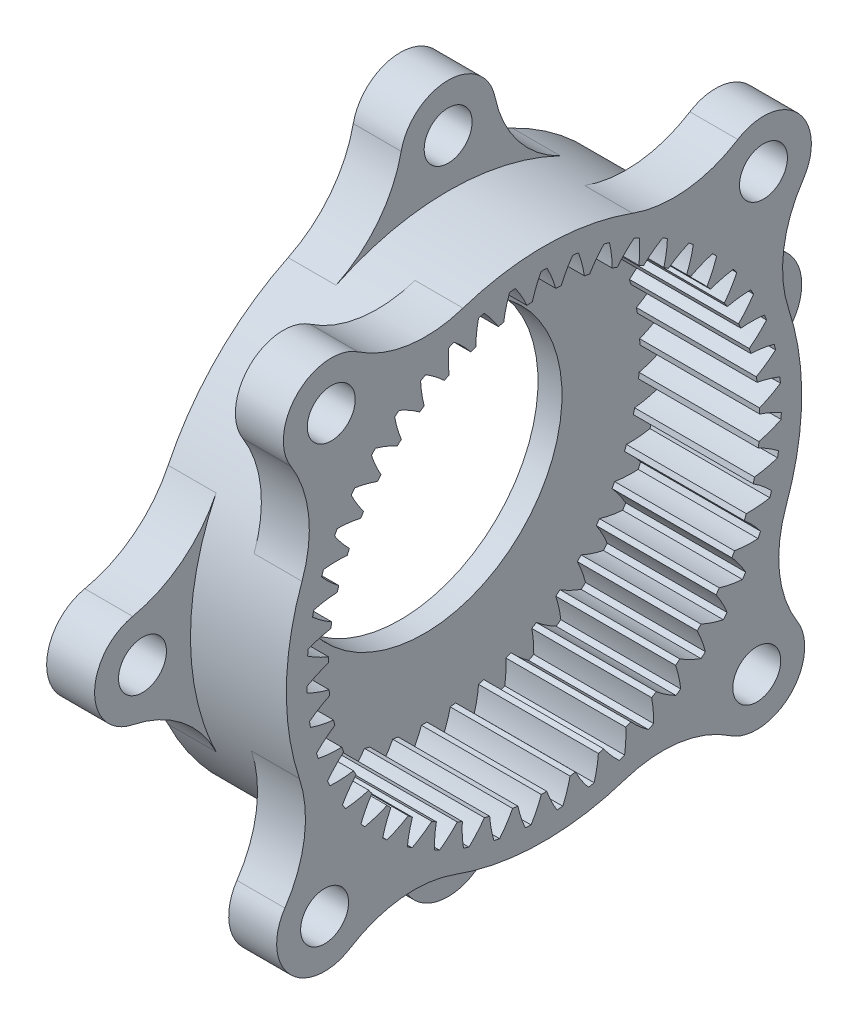
from build123d import *

# Parameters (mm, degrees)
BASPROSKE_W         = 12
BASPROSKE_H         = 3.5
TOOTHCUT_DEPTH      = 33.687918257
TEETHCUTS_COUNT     = 47
TEETHCUTS_ANGLE     = 352.340425532
BOSS_EXTRUDE1_START = -2
SKETCH1_R           = 21.5
BOSS_EXTRUDE1_DEPTH = 2
SKETCH2_R           = 11.5
CUT_EXTRUDE1_DEPTH  = 33.687918257
SKETCH3_R           = 2
BOSS_EXTRUDE3_DEPTH = 4
FILLET1_R           = 10
SKETCH6_R           = 2
BOSS_EXTRUDE4_DEPTH = 4
FILLET2_R           = 10


with BuildPart() as part:
    # BasProSke → Base-Revolve (revolve)
    with BuildSketch(Plane(origin=(0, 0, 0), x_dir=(1, 0, 0), z_dir=(0, 1, 0)), mode=Mode.PRIVATE) as base_revolve_sk:
        with Locations((6, 19.75)):
            Rectangle(BASPROSKE_W, BASPROSKE_H)
    revolve(base_revolve_sk.sketch.rotate(Axis((-10, 0, 0), (1, 0, 0)), 180), axis=Axis((-10, 0, 0), (1, 0, 0)))

    # TooCutSke → ToothCut (cut, through all)
    with BuildSketch(Plane(origin=(0, 0, 0), x_dir=(0, 0, -1), z_dir=(1, 0, 0))):
        with BuildLine():
            ThreePointArc((0.983195286, 17.947689884), (0.661245829, 18.89336655), (0.240755418, 19.799536303))
            ThreePointArc((0.240755418, 19.799536303), (0, 19.801), (-0.240755418, 19.799536303))
            ThreePointArc((-0.240755418, 19.799536303), (-0.661245829, 18.89336655), (-0.983195286, 17.947689884))
            ThreePointArc((-0.983195286, 17.947689884), (0, 17.9746), (0.983195286, 17.947689884))
        make_face()
    toothcut = extrude(amount=TOOTHCUT_DEPTH, mode=Mode.SUBTRACT)

    # TeethCuts: ToothCut ×47 about axis
    teethcuts_axis = Axis((-10, 0, 0), (1, 0, 0))
    for i in range(1, TEETHCUTS_COUNT):
        add(toothcut.rotate(teethcuts_axis, i * TEETHCUTS_ANGLE / (TEETHCUTS_COUNT - 1)), mode=Mode.SUBTRACT)

    # Sketch1 → Boss-Extrude1 (add)
    with BuildSketch(Plane.ZY.offset(BOSS_EXTRUDE1_START)):
        Circle(SKETCH1_R)
    extrude(amount=BOSS_EXTRUDE1_DEPTH)

    # Sketch2 → Cut-Extrude1 (cut, through all)
    with BuildSketch(Plane.ZY):
        Circle(SKETCH2_R)
    extrude(amount=-CUT_EXTRUDE1_DEPTH, mode=Mode.SUBTRACT)

    # Sketch3 → Boss-Extrude3 (add)
    # profile 1 of 4: a face of its own
    with BuildSketch(Plane.ZY):
        with BuildLine():
            Line((-25.5, 4), (-20.096451941, 4))
            Line((-20.096451941, 4), (-20.096451941, -4))
            Line((-20.096451941, -4), (-25.5, -4))
            ThreePointArc((-25.5, -4), (-29.5, 0), (-25.5, 4))
        make_face()
        with Locations((-25.5, 0)):
            Circle(SKETCH3_R, mode=Mode.SUBTRACT)
    # profile 2 of 4: a face of its own
    with BuildSketch(Plane.ZY):
        with BuildLine():
            Line((4, 25.5), (4, 20.096451941))
            Line((4, 20.096451941), (-4, 20.096451941))
            Line((-4, 20.096451941), (-4, 25.5))
            ThreePointArc((-4, 25.5), (0, 29.5), (4, 25.5))
        make_face()
        with Locations((0, 25.5)):
            Circle(SKETCH3_R, mode=Mode.SUBTRACT)
    # profile 3 of 4: a face of its own
    with BuildSketch(Plane.ZY):
        with BuildLine():
            Line((25.5, -4), (20.096451941, -4))
            Line((20.096451941, -4), (20.096451941, 4))
            Line((20.096451941, 4), (25.5, 4))
            ThreePointArc((25.5, 4), (29.5, 0), (25.5, -4))
        make_face()
        with Locations((25.5, 0)):
            Circle(SKETCH3_R, mode=Mode.SUBTRACT)
    # profile 4 of 4: a face of its own
    with BuildSketch(Plane.ZY):
        with BuildLine():
            Line((-4, -25.5), (-4, -20.096451941))
            Line((-4, -20.096451941), (4, -20.096451941))
            Line((4, -20.096451941), (4, -25.5))
            ThreePointArc((4, -25.5), (0, -29.5), (-4, -25.5))
        make_face()
        with Locations((0, -25.5)):
            Circle(SKETCH3_R, mode=Mode.SUBTRACT)
    extrude(amount=-BOSS_EXTRUDE3_DEPTH)

    # Fillet1
    # the kernel refuses this fillet: 10 mm, written as the material it adds along each edge
    with BuildSketch(Plane(origin=(0, -21.124630174, 4), x_dir=(0, 0.3132537299732563, 0.9496694691616879), z_dir=(1, 0, 0)), Plane(origin=(0, 21.124630174, -4), x_dir=(0, -0.3132537299732253, -0.9496694691616983), z_dir=(1, 0, 0)), Plane(origin=(0, -4, -21.124630174), x_dir=(0, -0.9496694691617331, 0.3132537299731191), z_dir=(1, 0, 0))) as fillet1_piece_1:
        with BuildLine():
            CenterArc((6.948401858, 9.913688951), FILLET1_R, 210.054590585, 52.41213662)
            Line((-1.707084322, 4.905439857), (-2.57263294, 4.404614948))
            ThreePointArc((-2.57263294, 4.404614948), (-2.320270387, 3.84190141), (-0.949669469, -0.31325373))
            Line((-0.949669469, -0.31325373), (0.131101922, -0.991368895))
            ThreePointArc((0.131101922, -0.991368895), (2.81869132, -0.814431244), (5.506280718, -0.991368895))
            Line((5.506280718, -0.991368895), (5.637382639, 0))
        make_face()
    extrude(amount=4)
    with BuildSketch(Plane(origin=(0, -4, 21.124630174), x_dir=(0, 0.01627238713686747, 0.9998675959430168), z_dir=(1, 0, 0))) as fillet1_piece_2:
        with BuildLine():
            CenterArc((7.07924631, 9.82068168), FILLET1_R, 206.72107826, 52.41213662)
            Line((-1.852813991, 5.324205419), (-2.746020021, 4.874557792))
            ThreePointArc((-2.746020021, 4.874557792), (-1.695593605, 2.394427141), (-0.979383425, -0.202010165))
            Line((-0.979383425, -0.202010165), (0.016272387, -0.999867596))
            ThreePointArc((0.016272387, -0.999867596), (4.391062896, -0.928669884), (5.00545854, -0.982068168))
            Line((5.00545854, -0.982068168), (5.193984701, 0))
        make_face()
    extrude(amount=4)
    with BuildSketch(Plane(origin=(0, 4, 21.124630174), x_dir=(0, -0.0162723871367947, 0.9998675959430179), z_dir=(1, 0, 0))) as fillet1_piece_3:
        with BuildLine():
            CenterArc((7.07924631, -9.82068168), FILLET1_R, 100.86678512, 52.41213662)
            Line((-1.852813991, -5.324205419), (-2.746020021, -4.874557792))
            ThreePointArc((-2.746020021, -4.874557792), (-1.695593605, -2.394427141), (-0.979383425, 0.202010165))
            Line((-0.979383425, 0.202010165), (0.016272387, 0.999867596))
            ThreePointArc((0.016272387, 0.999867596), (4.391062896, 0.928669884), (5.00545854, 0.982068168))
            Line((5.00545854, 0.982068168), (5.193984701, 0))
        make_face()
    extrude(amount=4)
    with BuildSketch(Plane(origin=(0, 21.124630174, 4), x_dir=(0, -0.31325372997304163, 0.9496694691617588), z_dir=(1, 0, 0)), Plane(origin=(0, 4, -21.124630174), x_dir=(0, 0.9496694691617331, 0.3132537299731191), z_dir=(1, 0, 0)), Plane(origin=(0, -21.124630174, -4), x_dir=(0, 0.3132537299729657, -0.9496694691617839), z_dir=(1, 0, 0))) as fillet1_piece_4:
        with BuildLine():
            CenterArc((6.948401858, -9.913688951), FILLET1_R, 97.533272794, 52.41213662)
            Line((-1.707084322, -4.905439857), (-2.57263294, -4.404614948))
            ThreePointArc((-2.57263294, -4.404614948), (-2.320270387, -3.84190141), (-0.949669469, 0.31325373))
            Line((-0.949669469, 0.31325373), (0.131101922, 0.991368895))
            ThreePointArc((0.131101922, 0.991368895), (2.81869132, 0.814431244), (5.506280718, 0.991368895))
            Line((5.506280718, 0.991368895), (5.637382639, 0))
        make_face()
    extrude(amount=4)

    # Sketch6 → Boss-Extrude4 (add)
    # profile 1 of 4: a face of its own
    with BuildSketch(Plane(origin=(12, 0, 0), x_dir=(0, 0, -1), z_dir=(1, 0, 0))):
        with BuildLine():
            Line((-20.578660793, 15.479472939), (-16.726697913, 11.627510059))
            Line((-16.726697913, 11.627510059), (-11.069843664, 17.284364309))
            Line((-11.069843664, 17.284364309), (-14.921806543, 21.136327188))
            ThreePointArc((-14.921806543, 21.136327188), (-20.578660793, 21.136327188), (-20.578660793, 15.479472939))
        make_face()
        with Locations((-17.750233668, 18.307900063)):
            Circle(SKETCH6_R, mode=Mode.SUBTRACT)
    # profile 2 of 4: a face of its own
    with BuildSketch(Plane(origin=(12, 0, 0), x_dir=(0, 0, -1), z_dir=(1, 0, 0))):
        with BuildLine():
            Line((11.627510059, 16.726697913), (17.284364309, 11.069843664))
            Line((17.284364309, 11.069843664), (21.136327188, 14.921806543))
            ThreePointArc((21.136327188, 14.921806543), (21.136327188, 20.578660793), (15.479472939, 20.578660793))
            Line((15.479472939, 20.578660793), (11.627510059, 16.726697913))
        make_face()
        with Locations((18.307900063, 17.750233668)):
            Circle(SKETCH6_R, mode=Mode.SUBTRACT)
    # profile 3 of 4: a face of its own
    with BuildSketch(Plane(origin=(12, 0, 0), x_dir=(0, 0, -1), z_dir=(1, 0, 0))):
        with BuildLine():
            Line((16.726697913, -11.627510059), (11.069843664, -17.284364309))
            Line((11.069843664, -17.284364309), (14.921806543, -21.136327188))
            ThreePointArc((14.921806543, -21.136327188), (20.578660793, -21.136327188), (20.578660793, -15.479472939))
            Line((20.578660793, -15.479472939), (16.726697913, -11.627510059))
        make_face()
        with Locations((17.750233668, -18.307900063)):
            Circle(SKETCH6_R, mode=Mode.SUBTRACT)
    # profile 4 of 4: a face of its own
    with BuildSketch(Plane(origin=(12, 0, 0), x_dir=(0, 0, -1), z_dir=(1, 0, 0))):
        with BuildLine():
            Line((-11.627510059, -16.726697913), (-17.284364309, -11.069843664))
            Line((-17.284364309, -11.069843664), (-21.136327188, -14.921806543))
            ThreePointArc((-21.136327188, -14.921806543), (-21.136327188, -20.578660793), (-15.479472939, -20.578660793))
            Line((-15.479472939, -20.578660793), (-11.627510059, -16.726697913))
        make_face()
        with Locations((-18.307900063, -17.750233668)):
            Circle(SKETCH6_R, mode=Mode.SUBTRACT)
    extrude(amount=-BOSS_EXTRUDE4_DEPTH)

    # Fillet2
    # the kernel refuses this fillet: 10 mm, written as the material it adds along each edge
    with BuildSketch(Plane(origin=(8, -11.774605599, 17.989126243), x_dir=(0, 0.9005783714328741, 0.43469368169702266), z_dir=(1, 0, 0)), Plane(origin=(8, -17.989126243, -11.774605599), x_dir=(0, -0.43469368169715, 0.9005783714328125), z_dir=(1, 0, 0)), Plane(origin=(8, 11.774605599, -17.989126243), x_dir=(0, -0.9005783714328617, -0.4346936816970479), z_dir=(1, 0, 0)), Plane(origin=(8, 17.989126243, 11.774605599), x_dir=(0, 0.4346936816969203, -0.9005783714329233), z_dir=(1, 0, 0))) as fillet2_piece_1:
        with BuildLine():
            CenterArc((6.86336594, 9.915797523), FILLET2_R, 210.147309343, 52.41213662)
            Line((-1.784004324, 4.893548273), (-2.648741351, 4.391323348))
            ThreePointArc((-2.648741351, 4.391323348), (-2.410412659, 3.872939244), (-0.944179923, -0.329430223))
            Line((-0.944179923, -0.329430223), (0.129497471, -0.991579752))
            ThreePointArc((0.129497471, -0.991579752), (2.784195617, -0.818964674), (5.438893763, -0.991579752))
            Line((5.438893763, -0.991579752), (5.568391234, 0))
        make_face()
    extrude(amount=4)
    with BuildSketch(Plane(origin=(8, -17.537074396, 12.437886542), x_dir=(0, -0.4651735564160385, -0.885219499565647), z_dir=(1, 0, 0)), Plane(origin=(8, -12.437886542, -17.537074396), x_dir=(0, 0.885219499565721, -0.46517355641589797), z_dir=(1, 0, 0)), Plane(origin=(8, 17.537074396, -12.437886542), x_dir=(0, 0.4651735564159733, 0.8852194995656815), z_dir=(1, 0, 0)), Plane(origin=(8, 12.437886542, 17.537074396), x_dir=(0, -0.8852194995656072, 0.46517355641611424), z_dir=(1, 0, 0))) as fillet2_piece_2:
        with BuildLine():
            CenterArc((7.031686094, -9.911598204), FILLET2_R, 97.624100843, 52.41213662)
            Line((-1.631728527, -4.917076494), (-2.498069989, -4.417624323))
            ThreePointArc((-2.498069989, -4.417624323), (-2.232478114, -3.810319815), (-0.954872087, 0.297017335))
            Line((-0.954872087, 0.297017335), (0.132673323, 0.99115982))
            ThreePointArc((0.132673323, 0.99115982), (2.852476434, 0.809936138), (5.572279546, 0.99115982))
            Line((5.572279546, 0.99115982), (5.704952869, 0))
        make_face()
    extrude(amount=4)


solid = part.part
